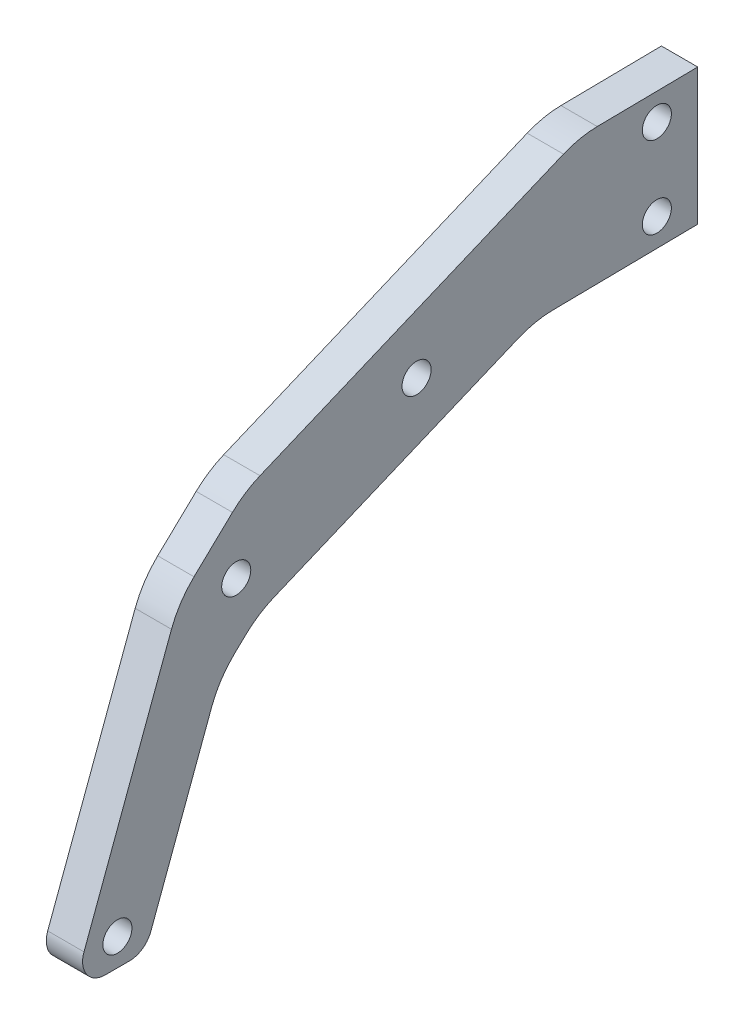
from build123d import *

# Parameters (mm, degrees)
SKETCH1_R           = 1.6
BOSS_EXTRUDE1_DEPTH = 4
FILLET1_R           = 10


with BuildPart() as part:
    # Sketch1 → Boss-Extrude1 (new body)
    with BuildSketch(Plane(origin=(0, 0, 0), x_dir=(0, 0, -1), z_dir=(1, 0, 0))):
        with BuildLine():
            ThreePointArc((1.250877394, 3.369963182), (1.54220103, 1.072573637), (3.594627394, 0))
            Line((3.594627394, 0), (6.26129406, 0))
            ThreePointArc((6.26129406, 0), (7.688720424, 0.447573637), (8.60504406, 1.630036818))
            Line((8.60504406, 1.630036818), (16.138282763, 21.925181005))
            Line((16.138282763, 21.925181005), (20.42668985, 26.002896629))
            Line((20.42668985, 26.002896629), (50.91386883, 38.739566173))
            Line((50.91386883, 38.739566173), (68.844719883, 38.977888478))
            Line((68.844719883, 38.977888478), (68.844719883, 53.977888478))
            Line((68.844719883, 53.977888478), (55.845867993, 53.805118299))
            Line((55.845867993, 53.805118299), (18.937282625, 38.385769218))
            Line((18.937282625, 38.385769218), (11.690435574, 31.494963182))
            Line((11.690435574, 31.494963182), (1.250877394, 3.369963182))
        make_face()
        with Locations((4.927960727, 3)):
            Circle(SKETCH1_R, mode=Mode.SUBTRACT)
        with Locations((18.016916415, 30.611068767)):
            Circle(SKETCH1_R, mode=Mode.SUBTRACT)
        with Locations((37.879973994, 39.796930611)):
            Circle(SKETCH1_R, mode=Mode.SUBTRACT)
        with Locations((64.340323045, 41.977889552)):
            Circle(SKETCH1_R, mode=Mode.SUBTRACT)
        with Locations((64.344719883, 50.977888478)):
            Circle(SKETCH1_R, mode=Mode.SUBTRACT)
    extrude(amount=BOSS_EXTRUDE1_DEPTH)

    # Fillet1
    fillet1_edges = [part.edges().sort_by_distance(p)[0] for p in [
        (2, 53.805118299, -55.845867993),
        (2, 31.494963182, -11.690435574),
        (2, 38.385769218, -18.937282625),
        (2, 21.925181005, -16.138282763),
        (2, 26.002896629, -20.42668985),
        (2, 38.739566173, -50.91386883),
    ]]
    fillet(fillet1_edges, radius=FILLET1_R)


solid = part.part
